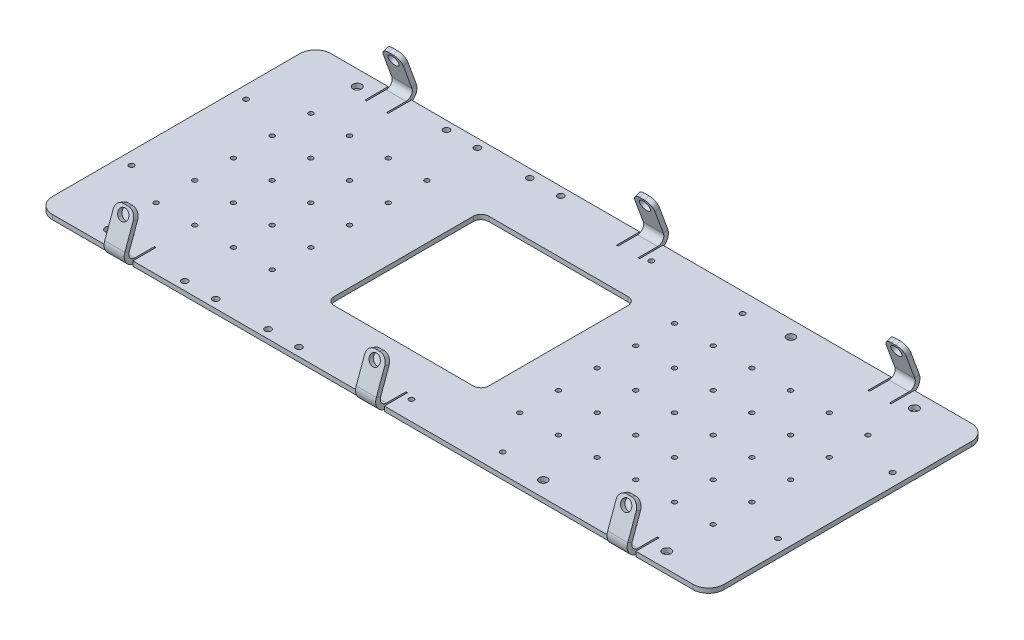
from build123d import *

# Parameters (mm, degrees)
SKETCH2_W            = 434
SKETCH2_H            = 180
BASE_FLANGE1_DEPTH   = 3
FILLET1_R            = 10
CUT_EXTRUDE1_REACH   = 236.943
SKETCH7_R            = 2
CUT_EXTRUDE2_REACH   = 236.943
SKETCH8_R            = 2.75
CUT_EXTRUDE3_DEPTH   = 10
SKETCH10_R           = 1.5
CUT_EXTRUDE4_DEPTH   = 10
SKETCH11_R           = 1.65
CUT_EXTRUDE5_DEPTH   = 3
SKETCH20_W           = 15
SKETCH20_H           = 15
CUT_EXTRUDE7_DEPTH   = 3
EDGE_FLANGE3_START   = -169
EDGE_FLANGE3_DEPTH   = 13
EDGE_FLANGE3_START_2 = -6.5
EDGE_FLANGE3_2_DEPTH = 13
EDGE_FLANGE3_START_3 = 156
EDGE_FLANGE3_3_DEPTH = 13
FILLET3_R            = 5
SKETCH31_R           = 3.46
CUT_EXTRUDE12_DEPTH  = 3
FILLET3_OF_MIRROR1_R = 5
SKETCH32_R           = 2.65
SKETCH32_R_2         = 1.6
CUT_EXTRUDE13_DEPTH  = 3


# Read off the part's stored shape, not the designer's step: Edge-Flange3
# Sheet-metal steps are written as plain solids
with BuildPart() as part:
    # Sketch2 → Base-Flange1 (new body)
    with BuildSketch(Plane(origin=(0, 0, 0), x_dir=(1, 0, 0), z_dir=(0, 1, 0))):
        Rectangle(SKETCH2_W, SKETCH2_H)
    extrude(amount=-BASE_FLANGE1_DEPTH)

    # Fillet1
    fillet1_edges = [part.edges().sort_by_distance(p)[0] for p in [
        (217, -1.5, 90),
        (-217, -1.5, 90),
        (-217, -1.5, -90),
        (217, -1.5, -90),
    ]]
    fillet(fillet1_edges, radius=FILLET1_R)

    # Sketch7 → Cut-Extrude1 (cut, up to next)
    with BuildSketch(Plane(origin=(0, 0, 0), x_dir=(1, 0, 0), z_dir=(0, 1, 0)), mode=Mode.PRIVATE) as cut_extrude1_sk1:
        with Locations(Location((-126.9, -84.55, 0), (0, 0, 270))):
            Circle(SKETCH7_R)
    cut_extrude1_tool1 = extrude(cut_extrude1_sk1.sketch, amount=-CUT_EXTRUDE1_REACH, mode=Mode.PRIVATE) & part.part
    # Sketch7 → Cut-Extrude1 (cut, up to next)
    with BuildSketch(Plane(origin=(0, 0, 0), x_dir=(1, 0, 0), z_dir=(0, 1, 0)), mode=Mode.PRIVATE) as cut_extrude1_sk2:
        with Locations(Location((-73.1, -84.55, 0), (0, 0, 270))):
            Circle(SKETCH7_R)
    cut_extrude1_tool2 = extrude(cut_extrude1_sk2.sketch, amount=-CUT_EXTRUDE1_REACH, mode=Mode.PRIVATE) & part.part
    # Sketch7 → Cut-Extrude1 (cut, up to next)
    with BuildSketch(Plane(origin=(0, 0, 0), x_dir=(1, 0, 0), z_dir=(0, 1, 0)), mode=Mode.PRIVATE) as cut_extrude1_sk3:
        with Locations(Location((-73.1, 84.55, 0), (0, 0, 270))):
            Circle(SKETCH7_R)
    cut_extrude1_tool3 = extrude(cut_extrude1_sk3.sketch, amount=-CUT_EXTRUDE1_REACH, mode=Mode.PRIVATE) & part.part
    # Sketch7 → Cut-Extrude1 (cut, up to next)
    with BuildSketch(Plane(origin=(0, 0, 0), x_dir=(1, 0, 0), z_dir=(0, 1, 0)), mode=Mode.PRIVATE) as cut_extrude1_sk4:
        with Locations(Location((-126.9, 84.55, 0), (0, 0, 270))):
            Circle(SKETCH7_R)
    cut_extrude1_tool4 = extrude(cut_extrude1_sk4.sketch, amount=-CUT_EXTRUDE1_REACH, mode=Mode.PRIVATE) & part.part
    # Sketch7 → Cut-Extrude1 (cut, up to next)
    with BuildSketch(Plane(origin=(0, 0, 0), x_dir=(1, 0, 0), z_dir=(0, 1, 0)), mode=Mode.PRIVATE) as cut_extrude1_sk5:
        with Locations(Location((-106.9, -84.55, 0), (0, 0, 270))):
            Circle(SKETCH7_R)
    cut_extrude1_tool5 = extrude(cut_extrude1_sk5.sketch, amount=-CUT_EXTRUDE1_REACH, mode=Mode.PRIVATE) & part.part
    # Sketch7 → Cut-Extrude1 (cut, up to next)
    with BuildSketch(Plane(origin=(0, 0, 0), x_dir=(1, 0, 0), z_dir=(0, 1, 0)), mode=Mode.PRIVATE) as cut_extrude1_sk6:
        with Locations(Location((-53.1, -84.55, 0), (0, 0, 270))):
            Circle(SKETCH7_R)
    cut_extrude1_tool6 = extrude(cut_extrude1_sk6.sketch, amount=-CUT_EXTRUDE1_REACH, mode=Mode.PRIVATE) & part.part
    # Sketch7 → Cut-Extrude1 (cut, up to next)
    with BuildSketch(Plane(origin=(0, 0, 0), x_dir=(1, 0, 0), z_dir=(0, 1, 0)), mode=Mode.PRIVATE) as cut_extrude1_sk7:
        with Locations(Location((-106.9, 84.55, 0), (0, 0, 270))):
            Circle(SKETCH7_R)
    cut_extrude1_tool7 = extrude(cut_extrude1_sk7.sketch, amount=-CUT_EXTRUDE1_REACH, mode=Mode.PRIVATE) & part.part
    # Sketch7 → Cut-Extrude1 (cut, up to next)
    with BuildSketch(Plane(origin=(0, 0, 0), x_dir=(1, 0, 0), z_dir=(0, 1, 0)), mode=Mode.PRIVATE) as cut_extrude1_sk8:
        with Locations(Location((-53.1, 84.55, 0), (0, 0, 270))):
            Circle(SKETCH7_R)
    cut_extrude1_tool8 = extrude(cut_extrude1_sk8.sketch, amount=-CUT_EXTRUDE1_REACH, mode=Mode.PRIVATE) & part.part
    add(cut_extrude1_tool1.solids().sort_by_distance((-126.9, 0, 84.55))[0], mode=Mode.SUBTRACT)
    add(cut_extrude1_tool2.solids().sort_by_distance((-73.1, 0, 84.55))[0], mode=Mode.SUBTRACT)
    add(cut_extrude1_tool3.solids().sort_by_distance((-73.1, 0, -84.55))[0], mode=Mode.SUBTRACT)
    add(cut_extrude1_tool4.solids().sort_by_distance((-126.9, 0, -84.55))[0], mode=Mode.SUBTRACT)
    add(cut_extrude1_tool5.solids().sort_by_distance((-106.9, 0, 84.55))[0], mode=Mode.SUBTRACT)
    add(cut_extrude1_tool6.solids().sort_by_distance((-53.1, 0, 84.55))[0], mode=Mode.SUBTRACT)
    add(cut_extrude1_tool7.solids().sort_by_distance((-106.9, 0, -84.55))[0], mode=Mode.SUBTRACT)
    add(cut_extrude1_tool8.solids().sort_by_distance((-53.1, 0, -84.55))[0], mode=Mode.SUBTRACT)

    # Sketch8 → Cut-Extrude2 (cut, up to next)
    with BuildSketch(Plane(origin=(0, 0, 0), x_dir=(1, 0, 0), z_dir=(0, 1, 0)), mode=Mode.PRIVATE) as cut_extrude2_sk1:
        with Locations(Location((-180, 80, 0), (0, 0, 270))):
            Circle(SKETCH8_R)
    cut_extrude2_tool1 = extrude(cut_extrude2_sk1.sketch, amount=-CUT_EXTRUDE2_REACH, mode=Mode.PRIVATE) & part.part
    # Sketch8 → Cut-Extrude2 (cut, up to next)
    with BuildSketch(Plane(origin=(0, 0, 0), x_dir=(1, 0, 0), z_dir=(0, 1, 0)), mode=Mode.PRIVATE) as cut_extrude2_sk2:
        with Locations(Location((180, 80, 0), (0, 0, 270))):
            Circle(SKETCH8_R)
    cut_extrude2_tool2 = extrude(cut_extrude2_sk2.sketch, amount=-CUT_EXTRUDE2_REACH, mode=Mode.PRIVATE) & part.part
    # Sketch8 → Cut-Extrude2 (cut, up to next)
    with BuildSketch(Plane(origin=(0, 0, 0), x_dir=(1, 0, 0), z_dir=(0, 1, 0)), mode=Mode.PRIVATE) as cut_extrude2_sk3:
        with Locations(Location((180, -80, 0), (0, 0, 270))):
            Circle(SKETCH8_R)
    cut_extrude2_tool3 = extrude(cut_extrude2_sk3.sketch, amount=-CUT_EXTRUDE2_REACH, mode=Mode.PRIVATE) & part.part
    # Sketch8 → Cut-Extrude2 (cut, up to next)
    with BuildSketch(Plane(origin=(0, 0, 0), x_dir=(1, 0, 0), z_dir=(0, 1, 0)), mode=Mode.PRIVATE) as cut_extrude2_sk4:
        with Locations(Location((-180, -80, 0), (0, 0, 270))):
            Circle(SKETCH8_R)
    cut_extrude2_tool4 = extrude(cut_extrude2_sk4.sketch, amount=-CUT_EXTRUDE2_REACH, mode=Mode.PRIVATE) & part.part
    add(cut_extrude2_tool1.solids().sort_by_distance((-180, 0, -80))[0], mode=Mode.SUBTRACT)
    add(cut_extrude2_tool2.solids().sort_by_distance((180, 0, -80))[0], mode=Mode.SUBTRACT)
    add(cut_extrude2_tool3.solids().sort_by_distance((180, 0, 80))[0], mode=Mode.SUBTRACT)
    add(cut_extrude2_tool4.solids().sort_by_distance((-180, 0, 80))[0], mode=Mode.SUBTRACT)

    # Sketch9 → Cut-Extrude3 (cut)
    with BuildSketch(Plane(origin=(0, 0, 0), x_dir=(1, 0, 0), z_dir=(0, 1, 0))):
        with BuildLine():
            Line((-65, 50), (25, 50))
            ThreePointArc((25, 50), (28.535533906, 48.535533906), (30, 45))
            Line((30, 45), (30, -45))
            ThreePointArc((30, -45), (28.535533906, -48.535533906), (25, -50))
            Line((25, -50), (-65, -50))
            ThreePointArc((-65, -50), (-68.535533906, -48.535533906), (-70, -45))
            Line((-70, -45), (-70, 45))
            ThreePointArc((-70, 45), (-68.535533906, 48.535533906), (-65, 50))
        make_face()
    extrude(amount=-CUT_EXTRUDE3_DEPTH, mode=Mode.SUBTRACT)

    # Sketch10 → Cut-Extrude4 (cut)
    with BuildSketch(Plane(origin=(0, 0, 0), x_dir=(1, 0, 0), z_dir=(0, 1, 0))):
        with Locations(Location((-180, 0, 0), (0, 0, 270))):
            Circle(SKETCH10_R)
        with Locations(Location((-180, 25, 0), (0, 0, 270))):
            Circle(SKETCH10_R)
        with Locations(Location((-180, 50, 0), (0, 0, 270))):
            Circle(SKETCH10_R)
        with Locations(Location((-180, -25, 0), (0, 0, 270))):
            Circle(SKETCH10_R)
        with Locations(Location((-180, -50, 0), (0, 0, 270))):
            Circle(SKETCH10_R)
        with Locations(Location((-155, 50, 0), (0, 0, 270))):
            Circle(SKETCH10_R)
        with Locations(Location((-155, 25, 0), (0, 0, 270))):
            Circle(SKETCH10_R)
        with Locations(Location((-155, 0, 0), (0, 0, 270))):
            Circle(SKETCH10_R)
        with Locations(Location((-155, -25, 0), (0, 0, 270))):
            Circle(SKETCH10_R)
        with Locations(Location((-155, -50, 0), (0, 0, 270))):
            Circle(SKETCH10_R)
        with Locations(Location((-130, 50, 0), (0, 0, 270))):
            Circle(SKETCH10_R)
        with Locations(Location((-130, 25, 0), (0, 0, 270))):
            Circle(SKETCH10_R)
        with Locations(Location((-130, 0, 0), (0, 0, 270))):
            Circle(SKETCH10_R)
        with Locations(Location((-130, -25, 0), (0, 0, 270))):
            Circle(SKETCH10_R)
        with Locations(Location((-130, -50, 0), (0, 0, 270))):
            Circle(SKETCH10_R)
        with Locations(Location((-105, 50, 0), (0, 0, 270))):
            Circle(SKETCH10_R)
        with Locations(Location((-105, 25, 0), (0, 0, 270))):
            Circle(SKETCH10_R)
        with Locations(Location((-105, 0, 0), (0, 0, 270))):
            Circle(SKETCH10_R)
        with Locations(Location((-105, -25, 0), (0, 0, 270))):
            Circle(SKETCH10_R)
        with Locations(Location((-105, -50, 0), (0, 0, 270))):
            Circle(SKETCH10_R)
        with Locations(Location((180, 0, 0), (0, 0, 270))):
            Circle(SKETCH10_R)
        with Locations(Location((180, 25, 0), (0, 0, 270))):
            Circle(SKETCH10_R)
        with Locations(Location((180, 50, 0), (0, 0, 270))):
            Circle(SKETCH10_R)
        with Locations(Location((180, -25, 0), (0, 0, 270))):
            Circle(SKETCH10_R)
        with Locations(Location((180, -50, 0), (0, 0, 270))):
            Circle(SKETCH10_R)
        with Locations(Location((155, 50, 0), (0, 0, 270))):
            Circle(SKETCH10_R)
        with Locations(Location((155, 25, 0), (0, 0, 270))):
            Circle(SKETCH10_R)
        with Locations(Location((155, 0, 0), (0, 0, 270))):
            Circle(SKETCH10_R)
        with Locations(Location((155, -25, 0), (0, 0, 270))):
            Circle(SKETCH10_R)
        with Locations(Location((155, -50, 0), (0, 0, 270))):
            Circle(SKETCH10_R)
        with Locations(Location((130, 50, 0), (0, 0, 270))):
            Circle(SKETCH10_R)
        with Locations(Location((130, 25, 0), (0, 0, 270))):
            Circle(SKETCH10_R)
        with Locations(Location((130, 0, 0), (0, 0, 270))):
            Circle(SKETCH10_R)
        with Locations(Location((130, -25, 0), (0, 0, 270))):
            Circle(SKETCH10_R)
        with Locations(Location((130, -50, 0), (0, 0, 270))):
            Circle(SKETCH10_R)
        with Locations(Location((105, 50, 0), (0, 0, 270))):
            Circle(SKETCH10_R)
        with Locations(Location((105, 25, 0), (0, 0, 270))):
            Circle(SKETCH10_R)
        with Locations(Location((105, 0, 0), (0, 0, 270))):
            Circle(SKETCH10_R)
        with Locations(Location((105, -25, 0), (0, 0, 270))):
            Circle(SKETCH10_R)
        with Locations(Location((105, -50, 0), (0, 0, 270))):
            Circle(SKETCH10_R)
        with Locations(Location((80, 50, 0), (0, 0, 270))):
            Circle(SKETCH10_R)
        with Locations(Location((80, 25, 0), (0, 0, 270))):
            Circle(SKETCH10_R)
        with Locations(Location((80, 0, 0), (0, 0, 270))):
            Circle(SKETCH10_R)
        with Locations(Location((80, -25, 0), (0, 0, 270))):
            Circle(SKETCH10_R)
        with Locations(Location((80, -50, 0), (0, 0, 270))):
            Circle(SKETCH10_R)
        with Locations(Location((55, 50, 0), (0, 0, 270))):
            Circle(SKETCH10_R)
        with Locations(Location((55, 25, 0), (0, 0, 270))):
            Circle(SKETCH10_R)
        with Locations(Location((55, 0, 0), (0, 0, 270))):
            Circle(SKETCH10_R)
        with Locations(Location((55, -25, 0), (0, 0, 270))):
            Circle(SKETCH10_R)
        with Locations(Location((55, -50, 0), (0, 0, 270))):
            Circle(SKETCH10_R)
    extrude(amount=-CUT_EXTRUDE4_DEPTH, mode=Mode.SUBTRACT)

    # Sketch11 → Cut-Extrude5 (cut)
    with BuildSketch(Plane(origin=(0, 0, 0), x_dir=(1, 0, 0), z_dir=(0, 1, 0))):
        with Locations(Location((-208.844821178, -37, 0), (0, 0, 270))):
            Circle(SKETCH11_R)
        with Locations(Location((-208.844821178, 37, 0), (0, 0, 270))):
            Circle(SKETCH11_R)
        with Locations(Location((208.844821178, -37, 0), (0, 0, 270))):
            Circle(SKETCH11_R)
        with Locations(Location((208.844821178, 37, 0), (0, 0, 270))):
            Circle(SKETCH11_R)
    extrude(amount=-CUT_EXTRUDE5_DEPTH, mode=Mode.SUBTRACT)

    # Sketch20 → Cut-Extrude7 (cut)
    with BuildSketch(Plane(origin=(0, 0, 0), x_dir=(1, 0, 0), z_dir=(0, 1, 0))):
        with Locations((-162.5, -82.5)):
            Rectangle(SKETCH20_W, SKETCH20_H)
        with Locations((162.5, -82.5)):
            Rectangle(SKETCH20_W, SKETCH20_H)
        with Locations((0, -82.5)):
            Rectangle(SKETCH20_W, SKETCH20_H)
    cut_extrude7 = extrude(amount=-CUT_EXTRUDE7_DEPTH, mode=Mode.SUBTRACT)

    # Edge-Flange3 outline → Edge-Flange3 (add)
    with BuildSketch(Plane.YZ.offset(EDGE_FLANGE3_START)):
        with BuildLine():
            Line((26.130471244, 86.98928626), (6.394141003, 94.172723001))
            ThreePointArc((6.394141003, 94.172723001), (-0.015035054, 93.328938966), (-3, 87.594874656))
            Line((-3, 87.594874656), (-3, 75))
            Line((-3, 75), (0, 75))
            Line((0, 75), (0, 87.594874656))
            ThreePointArc((0, 87.594874656), (1.705694255, 90.871482833), (5.368080573, 91.353645139))
            Line((5.368080573, 91.353645139), (25.104410814, 84.170208397))
            Line((25.104410814, 84.170208397), (26.130471244, 86.98928626))
        make_face()
    edge_flange3 = extrude(amount=EDGE_FLANGE3_DEPTH)

    # Edge-Flange3 2 outline → Edge-Flange3 2 (add)
    with BuildSketch(Plane.YZ.offset(EDGE_FLANGE3_START_2)):
        with BuildLine():
            Line((26.130471244, 86.98928626), (6.394141003, 94.172723001))
            ThreePointArc((6.394141003, 94.172723001), (-0.015035054, 93.328938966), (-3, 87.594874656))
            Line((-3, 87.594874656), (-3, 75))
            Line((-3, 75), (0, 75))
            Line((0, 75), (0, 87.594874656))
            ThreePointArc((0, 87.594874656), (1.705694255, 90.871482833), (5.368080573, 91.353645139))
            Line((5.368080573, 91.353645139), (25.104410814, 84.170208397))
            Line((25.104410814, 84.170208397), (26.130471244, 86.98928626))
        make_face()
    edge_flange3_2 = extrude(amount=EDGE_FLANGE3_2_DEPTH)

    # Edge-Flange3 3 outline → Edge-Flange3 3 (add)
    with BuildSketch(Plane.YZ.offset(EDGE_FLANGE3_START_3)):
        with BuildLine():
            Line((26.130471244, 86.98928626), (6.394141003, 94.172723001))
            ThreePointArc((6.394141003, 94.172723001), (-0.015035054, 93.328938966), (-3, 87.594874656))
            Line((-3, 87.594874656), (-3, 75))
            Line((-3, 75), (0, 75))
            Line((0, 75), (0, 87.594874656))
            ThreePointArc((0, 87.594874656), (1.705694255, 90.871482833), (5.368080573, 91.353645139))
            Line((5.368080573, 91.353645139), (25.104410814, 84.170208397))
            Line((25.104410814, 84.170208397), (26.130471244, 86.98928626))
        make_face()
    edge_flange3_3 = extrude(amount=EDGE_FLANGE3_3_DEPTH)

    # Fillet3
    fillet3_edges = [part.edges().sort_by_distance(p)[0] for p in [
        (-169, 25.617441029, 85.579747328),
        (-156, 25.617441029, 85.579747328),
        (-6.5, 25.617441029, 85.579747328),
        (6.5, 25.617441029, 85.579747328),
        (156, 25.617441029, 85.579747328),
        (169, 25.617441029, 85.579747328),
    ]]
    fillet(fillet3_edges, radius=FILLET3_R)

    # Sketch31 → Cut-Extrude12 (cut)
    with BuildSketch(Plane(origin=(0, 29.988441737, 82.392566518), x_dir=(-1, 0, 0), z_dir=(0, -0.34202014332565583, -0.9396926207859132))):
        with Locations(Location((162.5, -10.197477148, 0), (0, 0, 90))):
            Circle(SKETCH31_R)
        with Locations(Location((0, -10.197477148, 0), (0, 0, 90))):
            Circle(SKETCH31_R)
        with Locations(Location((-162.5, -10.197477148, 0), (0, 0, 90))):
            Circle(SKETCH31_R)
    cut_extrude12 = extrude(amount=-CUT_EXTRUDE12_DEPTH, mode=Mode.SUBTRACT)

    # Mirror1: Cut-Extrude7, Edge-Flange3, Edge-Flange3 2, Edge-Flange3 3, Cut-Extrude12 across plane
    add(cut_extrude7.mirror(Plane.XY), mode=Mode.SUBTRACT)
    add(edge_flange3.mirror(Plane.XY))
    add(edge_flange3_2.mirror(Plane.XY))
    add(edge_flange3_3.mirror(Plane.XY))
    add(cut_extrude12.mirror(Plane.XY), mode=Mode.SUBTRACT)

    # Fillet3 of Mirror1
    fillet3_of_mirror1_edges = [part.edges().sort_by_distance(p)[0] for p in [
        (-169, 25.617441029, -85.579747328),
        (-156, 25.617441029, -85.579747328),
        (-6.5, 25.617441029, -85.579747328),
        (6.5, 25.617441029, -85.579747328),
        (156, 25.617441029, -85.579747328),
        (169, 25.617441029, -85.579747328),
    ]]
    fillet(fillet3_of_mirror1_edges, radius=FILLET3_OF_MIRROR1_R)

    # Sketch32 → Cut-Extrude13 (cut)
    with BuildSketch(Plane.XZ.offset(3)):
        with Locations(Location((100.240168859, -80, 0), (0, 0, 270))):
            Circle(SKETCH32_R)
        with Locations(Location((71.5, -77.5, 0), (0, 0, 270))):
            Circle(SKETCH32_R_2)
        with Locations(Location((12.5, -77.5, 0), (0, 0, 270))):
            Circle(SKETCH32_R_2)
    cut_extrude13 = extrude(amount=-CUT_EXTRUDE13_DEPTH, mode=Mode.SUBTRACT)

    # Mirror2: Cut-Extrude13 across plane
    add(cut_extrude13.mirror(Plane.XY), mode=Mode.SUBTRACT)


solid = part.part
